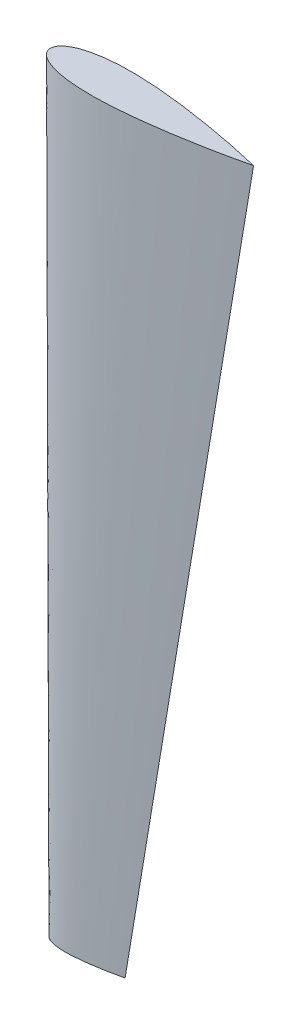
from build123d import *


with BuildPart() as part:
    # 草图2 → 放样1 section 0
    with BuildSketch(Plane(origin=(0, 0, 0), x_dir=(1, 0, 0), z_dir=(0, 1, 0))):
        with BuildLine():
            add(Edge.make_bspline(
                [(0, 0), (-3.576e-05, 0.084497569), (0.007477499, 0.23028724), (0.037669886, 0.441804118), (0.114670661, 0.716660066), (0.222591162, 0.97883952), (0.377825674, 1.257096948), (0.595324455, 1.557684708), (0.898563756, 1.887445773), (1.325744708, 2.256586438), (1.930829743, 2.670251676), (2.774686528, 3.121164923), (3.965533046, 3.608296591), (5.514291908, 4.072823407), (7.773847203, 4.547414656), (10.677192241, 4.893784098), (14.075153576, 5.04338755), (17.902472455, 4.976664507), (21.722121201, 4.738050775), (25.53097555, 4.369137888), (29.328557123, 3.898589047), (32.64129846, 3.41463723), (35.474365339, 2.955449458), (37.82973495, 2.545241631), (39.71261705, 2.200468958), (41.589312775, 1.840267173), (43.234103544, 1.509405454), (44.632694252, 1.217435308), (45.811213926, 0.963318516), (46.72663907, 0.76194688), (47.69590289, 0.5426851), (48.559880658, 0.343928912), (49.359546604, 0.154242876), (49.788490254, 0.051238236), (50, 0)],
                knots=[0, 0, 0, 0, 0, 0.005874531, 0.010168378, 0.014828146, 0.019835444, 0.025574736, 0.032308878, 0.040609511, 0.050966894, 0.064812119, 0.083253248, 0.107120705, 0.140429682, 0.177263566, 0.243881637, 0.310499708, 0.377117784, 0.443735861, 0.510353937, 0.576972013, 0.643590091, 0.67689913, 0.710208169, 0.743517207, 0.776826246, 0.810135286, 0.826789806, 0.843444325, 0.860098845, 0.876753365, 0.893407884, 0.910062404, 0.910062404, 0.910062404, 0.910062404, 0.910062404], degree=4))
            add(Edge.make_bspline(
                [(0, 0), (-3.576e-05, -0.084497569), (0.007477499, -0.23028724), (0.037669886, -0.441804118), (0.114670661, -0.716660066), (0.222591162, -0.97883952), (0.377825674, -1.257096948), (0.595324455, -1.557684708), (0.898563756, -1.887445773), (1.325744708, -2.256586438), (1.930829743, -2.670251676), (2.774686528, -3.121164923), (3.965533046, -3.608296591), (5.514291908, -4.072823407), (7.773847203, -4.547414656), (10.677192241, -4.893784098), (14.075153576, -5.04338755), (17.902472455, -4.976664507), (21.722121201, -4.738050775), (25.53097555, -4.369137888), (29.328557123, -3.898589047), (32.64129846, -3.41463723), (35.474365339, -2.955449458), (37.82973495, -2.545241631), (39.71261705, -2.200468958), (41.589312775, -1.840267173), (43.234103544, -1.509405454), (44.632694252, -1.217435308), (45.811213926, -0.963318516), (46.72663907, -0.76194688), (47.69590289, -0.5426851), (48.559880658, -0.343928912), (49.359546604, -0.154242876), (49.788490254, -0.051238236), (50, 0)],
                knots=[0, 0, 0, 0, 0, 0.005874531, 0.010168378, 0.014828146, 0.019835444, 0.025574736, 0.032308878, 0.040609511, 0.050966894, 0.064812119, 0.083253248, 0.107120705, 0.140429682, 0.177263566, 0.243881637, 0.310499708, 0.377117784, 0.443735861, 0.510353937, 0.576972013, 0.643590091, 0.67689913, 0.710208169, 0.743517207, 0.776826246, 0.810135286, 0.826789806, 0.843444325, 0.860098845, 0.876753365, 0.893407884, 0.910062404, 0.910062404, 0.910062404, 0.910062404, 0.910062404], degree=4))
        make_face()
    # 草图3 → 放样1 section 1
    with BuildSketch(Plane(origin=(0, 514, 0), x_dir=(1, 0, 0), z_dir=(0, 1, 0))):
        with BuildLine():
            add(Edge.make_bspline(
                [(0, 0), (-9.6239e-05, 0.229826737), (0.020338686, 0.626377201), (0.102461083, 1.201713894), (0.311904811, 1.949311826), (0.60544768, 2.662445554), (1.027685977, 3.419302575), (1.619282695, 4.236902988), (2.444092964, 5.133852215), (3.6060265, 6.137915117), (5.251855264, 7.263084811), (7.547150164, 8.489567998), (10.786245051, 9.814567846), (14.998881946, 11.078077768), (21.144850206, 12.368971283), (29.041989656, 13.311086271), (38.284374304, 13.718024659), (48.694788276, 13.536512137), (59.084069855, 12.887522311), (69.444418675, 11.884014996), (79.773385654, 10.604232473), (88.784800012, 9.287699714), (96.489545481, 8.038999144), (102.898095596, 6.922762194), (108.015717075, 5.985906459), (112.489020463, 5.126984847), (116.313274012, 4.363983128), (119.503911267, 3.707274265), (121.721649175, 3.240705223), (123.647234719, 2.827002442), (125.521665439, 2.41932597), (127.174331301, 2.052257293), (128.651437019, 1.722224062), (130.720100002, 1.247696687), (132.316911758, 0.880619788), (134.292315332, 0.411219701), (135.42469349, 0.139368002), (136, 0)],
                knots=[0, 0, 0, 0, 0, 0.005874531, 0.010168378, 0.014828146, 0.019835444, 0.025574736, 0.032308878, 0.040609511, 0.050966894, 0.064812119, 0.083253248, 0.107120705, 0.140429682, 0.177263566, 0.243881637, 0.310499708, 0.377117784, 0.443735861, 0.510353937, 0.576972013, 0.643590091, 0.67689913, 0.710208169, 0.743517207, 0.776826246, 0.793480766, 0.810135286, 0.826789806, 0.835117066, 0.843444325, 0.860098845, 0.868426105, 0.876753365, 0.893407884, 0.910062404, 0.910062404, 0.910062404, 0.910062404, 0.910062404], degree=4))
            add(Edge.make_bspline(
                [(0, 0), (-9.6239e-05, -0.229826737), (0.020338686, -0.626377201), (0.102461083, -1.201713894), (0.311904811, -1.949311826), (0.60544768, -2.662445554), (1.027685977, -3.419302575), (1.619282695, -4.236902988), (2.444092964, -5.133852215), (3.6060265, -6.137915117), (5.251855264, -7.263084811), (7.547150164, -8.489567998), (10.786245051, -9.814567846), (14.998881946, -11.078077768), (21.144850206, -12.368971283), (29.041989656, -13.311086271), (38.284374304, -13.718024659), (48.694788276, -13.536512137), (59.084069855, -12.887522311), (69.444418675, -11.884014996), (79.773385654, -10.604232473), (88.784800012, -9.287699714), (96.489545481, -8.038999144), (102.898095596, -6.922762194), (108.015717075, -5.985906459), (112.489020463, -5.126984847), (116.313274012, -4.363983128), (119.503911267, -3.707274265), (121.721649175, -3.240705223), (123.647234719, -2.827002442), (125.521665439, -2.41932597), (127.174331301, -2.052257293), (128.651437019, -1.722224062), (130.720100002, -1.247696687), (132.316911758, -0.880619788), (134.292315332, -0.411219701), (135.42469349, -0.139368002), (136, 0)],
                knots=[0, 0, 0, 0, 0, 0.005874531, 0.010168378, 0.014828146, 0.019835444, 0.025574736, 0.032308878, 0.040609511, 0.050966894, 0.064812119, 0.083253248, 0.107120705, 0.140429682, 0.177263566, 0.243881637, 0.310499708, 0.377117784, 0.443735861, 0.510353937, 0.576972013, 0.643590091, 0.67689913, 0.710208169, 0.743517207, 0.776826246, 0.793480766, 0.810135286, 0.826789806, 0.835117066, 0.843444325, 0.860098845, 0.868426105, 0.876753365, 0.893407884, 0.910062404, 0.910062404, 0.910062404, 0.910062404, 0.910062404], degree=4))
        make_face()
    loft()


solid = part.part
